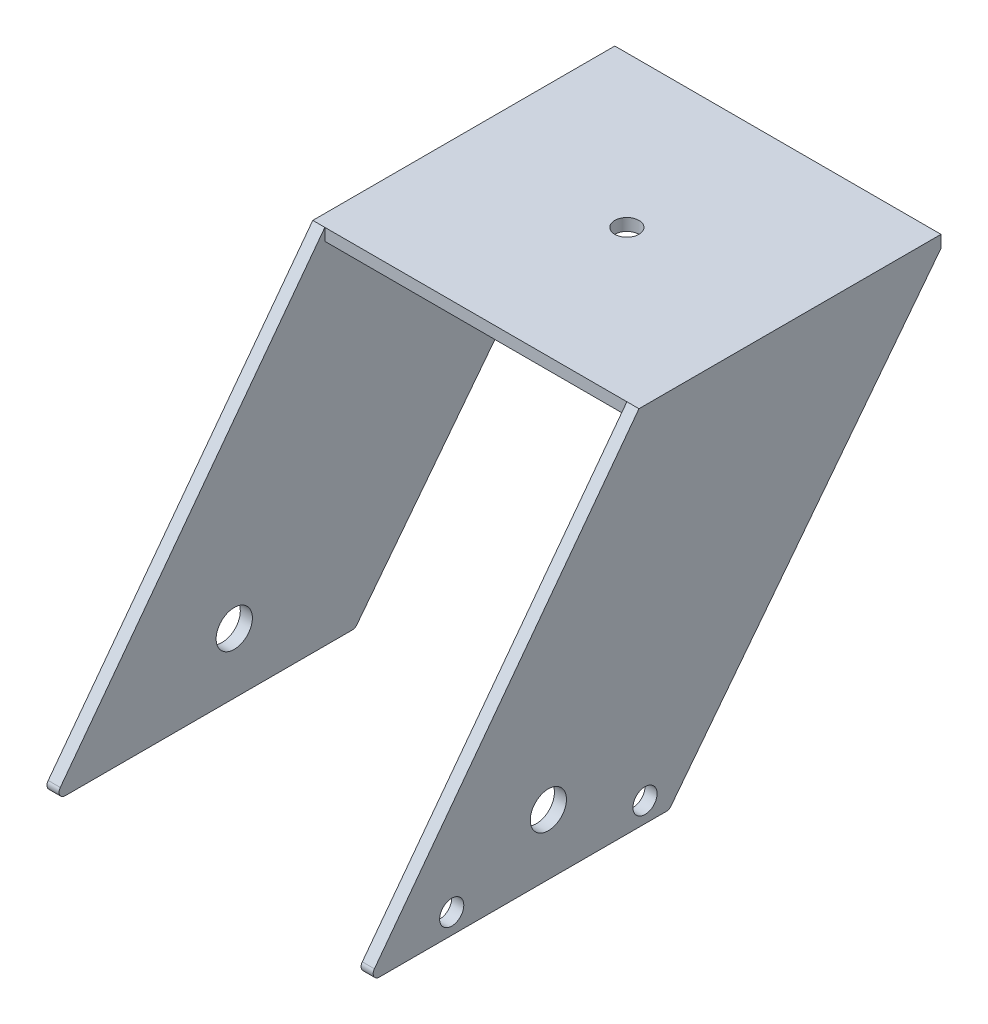
from build123d import *

# Parameters (mm, degrees)
SKETCH2_W           = 50
SKETCH2_H           = 50
SKETCH2_R           = 2
BOSS_EXTRUDE1_DEPTH = 2
SKETCH4_R           = 3
BOSS_EXTRUDE2_DEPTH = 2
BOSS_EXTRUDE3_START = 2
SKETCH3_R           = 3
SKETCH3_R_2         = 2
BOSS_EXTRUDE3_DEPTH = 2
FILLET1_R           = 1
FILLET2_R           = 1


with BuildPart() as part:
    # Sketch2 → Boss-Extrude1 (new body)
    with BuildSketch(Plane(origin=(0, 0, 0), x_dir=(1, 0, 0), z_dir=(0, 1, 0))):
        Rectangle(SKETCH2_W, SKETCH2_H)
        Circle(SKETCH2_R, mode=Mode.SUBTRACT)
    extrude(amount=BOSS_EXTRUDE1_DEPTH)

    # Sketch4 → Boss-Extrude2 (add)
    with BuildSketch(Plane.ZY.offset(25)):
        Polygon((25, 2), (-25, 2), (-25, 0.026324244), (20, -58), (70, -58), align=None)
        with Locations((40, -48)):
            Circle(SKETCH4_R, mode=Mode.SUBTRACT)
    extrude(amount=BOSS_EXTRUDE2_DEPTH)

    # Sketch3 → Boss-Extrude3 (add)
    with BuildSketch(Plane(origin=(25, 0, 0), x_dir=(0, 0, -1), z_dir=(1, 0, 0)).offset(BOSS_EXTRUDE3_START)):
        Polygon((-25, 2), (-70, -58), (-20, -58), (25, 0), (25, 2), align=None)
        with Locations((-40, -48)):
            Circle(SKETCH3_R, mode=Mode.SUBTRACT)
        with Locations((-56, -54.68)):
            Circle(SKETCH3_R_2, mode=Mode.SUBTRACT)
        with Locations((-24, -54.683)):
            Circle(SKETCH3_R_2, mode=Mode.SUBTRACT)
    extrude(amount=-BOSS_EXTRUDE3_DEPTH)

    # Fillet1
    fillet1_edges = [part.edges().sort_by_distance(p)[0] for p in [
        (26, -58, 20),
        (-26, -58, 20),
    ]]
    fillet(fillet1_edges, radius=FILLET1_R)

    # Fillet2
    fillet2_edges = [part.edges().sort_by_distance(p)[0] for p in [
        (26, -58, 70),
        (-26, -58, 70),
    ]]
    fillet(fillet2_edges, radius=FILLET2_R)


solid = part.part
